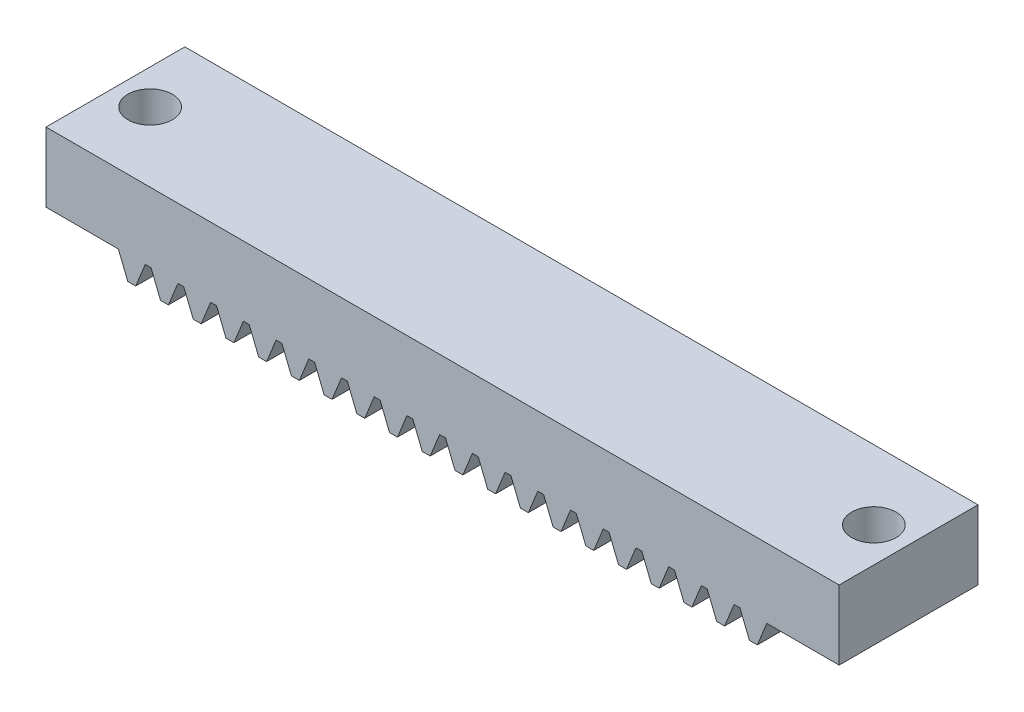
from build123d import *

# Parameters (mm, degrees)
SKETCH1_R           = 6.75
BOSS_EXTRUDE1_DEPTH = 10
CUT_EXTRUDE3_DEPTH  = 14.824796563
FILLET1_R           = 0.01
CIRPATTERN1_DEPTH   = 10
BOSS_EXTRUDE2_DEPTH = 10
FILLET2_R           = 0.01
LPATTERN7_DEPTH     = 10
SKETCH5_W           = 5
SKETCH5_H           = 10
SKETCH5_R           = 1.6
BOSS_EXTRUDE3_DEPTH = 5


# Read off the part's stored shape, not the designer's step: CirPattern1, LPattern7
with BuildPart() as part:
    # Sketch1 → Boss-Extrude1 (new body)
    with BuildSketch(Plane.XY):
        Circle(SKETCH1_R)
    extrude(amount=BOSS_EXTRUDE1_DEPTH)

    # Sketch3 → Cut-Extrude3 (cut, through all)
    with BuildSketch(Plane.XY):
        with BuildLine():
            add(Edge.make_bspline(
                [(0.434163713, 5.546135436), (0.436630111, 5.568887632), (0.447025975, 5.619389016), (0.472378991, 5.707357547), (0.514598388, 5.8199145), (0.556796354, 5.910501464), (0.584227269, 5.963693803), (0.588102842, 5.97110836)],
                knots=[0, 0, 0, 0, 0.040008387, 0.090017613, 0.160030412, 0.250046806, 0.264674884, 0.264674884, 0.264674884, 0.264674884], degree=3))
            add(Edge.make_bspline(
                [(0.588102842, 5.97110836), (0.647776123, 6.085272362), (0.763412421, 6.267141587), (0.941222365, 6.491761304), (1.047182351, 6.60848955), (1.096933403, 6.660273051)],
                knots=[0.264674884, 0.264674884, 0.264674884, 0.264674884, 0.489907489, 0.63993471, 0.765498984, 0.765498984, 0.765498984, 0.765498984], degree=3))
            ThreePointArc((1.096933403, 6.660273051), (0, 6.75), (-1.096933403, 6.660273051))
            add(Edge.make_bspline(
                [(-0.588102842, 5.97110836), (-0.647776123, 6.085272362), (-0.763412421, 6.267141587), (-0.941222365, 6.491761304), (-1.047182351, 6.60848955), (-1.096933403, 6.660273051)],
                knots=[0.264674884, 0.264674884, 0.264674884, 0.264674884, 0.489907489, 0.63993471, 0.765498984, 0.765498984, 0.765498984, 0.765498984], degree=3))
            add(Edge.make_bspline(
                [(-0.434163713, 5.546135436), (-0.436630111, 5.568887632), (-0.447025975, 5.619389016), (-0.472378991, 5.707357547), (-0.514598388, 5.8199145), (-0.556796354, 5.910501464), (-0.584227269, 5.963693803), (-0.588102842, 5.97110836)],
                knots=[0, 0, 0, 0, 0.040008387, 0.090017613, 0.160030412, 0.250046806, 0.264674884, 0.264674884, 0.264674884, 0.264674884], degree=3))
            Line((-0.434163713, 5.546135436), (-0.395094922, 5.047059169))
            ThreePointArc((-0.395094922, 5.047059169), (0, 5.0625), (0.395094922, 5.047059169))
            Line((0.395094922, 5.047059169), (0.434163713, 5.546135436))
        make_face()
    extrude(amount=CUT_EXTRUDE3_DEPTH, mode=Mode.SUBTRACT)

    # Fillet1
    # the kernel refuses this fillet: 0.01 mm, written as the material it adds along each edge
    with BuildSketch(Plane(origin=(-0.395094922, 5.047059169, 0), x_dir=(0.9970264029497734, 0.07706070218364215, 0), z_dir=(0, 0, 1))) as fillet1_piece_1:
        with BuildLine():
            CenterArc((0.009990148, 0.009999995), FILLET1_R, 180.056476902, 89.887046197)
            Line((-9.847e-06, 0.009990138), (0, 0))
            ThreePointArc((0, 0), (0.004990145, 2.459e-06), (0.009980291, 0))
        make_face()
    extrude(amount=10)
    with BuildSketch(Plane(origin=(0.395094922, 5.047059169, 0), x_dir=(0.0780434413729648, 0.9969499592550595, 0), z_dir=(0, 0, 1))) as fillet1_piece_2:
        with BuildLine():
            CenterArc((0.009990143, 0.01), FILLET1_R, 180.112953803, 89.887046197)
            ThreePointArc((-9.838e-06, 0.009980286), (-2.459e-06, 0.004990145), (0, 0))
            Line((0, 0), (0.009990143, 0))
        make_face()
    extrude(amount=10)
    # the kernel refuses this fillet: 0.01 mm, written as the material it takes off along each edge
    with BuildSketch(Plane(origin=(-1.096933403, 6.660273051, -0.0131876), x_dir=(-0.9866435807268535, -0.16289396738520714, 0), z_dir=(0, 0, 1))) as fillet1_2_piece_1:
        with BuildLine():
            CenterArc((0.005268096, 0.009999999), FILLET1_R, 214.398825468, 55.623549601)
            ThreePointArc((-0.002983155, 0.004350498), (-0.001492332, 0.002174732), (0, 0))
            ThreePointArc((0, 0), (0.002636001, -5.15e-07), (0.005272001, 0))
        make_face()
    extrude(amount=10.0263752, mode=Mode.SUBTRACT)
    with BuildSketch(Plane(origin=(1.096933403, 6.660273051, -0.0131876), x_dir=(0.9866435807268739, -0.16289396738508377, 0), z_dir=(0, 0, 1))) as fillet1_2_piece_2:
        with BuildLine():
            CenterArc((0.005268096, -0.009999999), FILLET1_R, 89.977624931, 55.623549601)
            ThreePointArc((-0.002983155, -0.004350498), (-0.001492332, -0.002174732), (0, 0))
            ThreePointArc((0, 0), (0.002636001, 5.15e-07), (0.005272001, 0))
        make_face()
    extrude(amount=10.0263752, mode=Mode.SUBTRACT)

    # CirPattern1 outline → CirPattern1 (cut)
    with BuildSketch(Plane.XY):
        with BuildLine():
            ThreePointArc((-1.530207553, 6.574265346), (-2.583113168, 6.236186844), (-3.56668747, 5.730727745))
            ThreePointArc((-3.56668747, 5.730727745), (-3.562115941, 5.732212366), (-3.557379814, 5.731392561))
            add(Edge.make_bspline(
                [(-2.523529113, 4.957813754), (-2.534514656, 4.977890192), (-2.563445225, 5.020569063), (-2.620532457, 5.092139209), (-2.702611775, 5.17997161), (-2.871243037, 5.334615924), (-3.096323549, 5.493864718), (-3.352329382, 5.636558939), (-3.493249428, 5.703206224), (-3.557379814, 5.731392561)],
                knots=[0, 0, 0, 0, 0.040008387, 0.090017613, 0.160030412, 0.250046806, 0.489907489, 0.63993471, 0.762424399, 0.762424399, 0.762424399, 0.762424399], degree=3))
            Line((-2.523529113, 4.957813754), (-2.300977756, 4.520581557))
            ThreePointArc((-2.300977756, 4.520581557), (-2.295169305, 4.515611526), (-2.287547187, 4.516196864))
            ThreePointArc((-2.287547187, 4.516196864), (-1.937334876, 4.677140133), (-1.5758933, 4.810973556))
            ThreePointArc((-1.5758933, 4.810973556), (-1.570089751, 4.815949311), (-1.569496899, 4.823570849))
            Line((-1.569496899, 4.823570849), (-1.721299177, 5.290108274))
            add(Edge.make_bspline(
                [(-1.721299177, 5.290108274), (-1.72772741, 5.312072411), (-1.737448928, 5.362707932), (-1.747689894, 5.453682436), (-1.751757939, 5.573828165), (-1.741867673, 5.802418517), (-1.695317619, 6.074180375), (-1.61519421, 6.356103888), (-1.562675436, 6.502876154), (-1.537259155, 6.568153935)],
                knots=[0, 0, 0, 0, 0.040008387, 0.090017613, 0.160030412, 0.250046806, 0.489907489, 0.63993471, 0.762424399, 0.762424399, 0.762424399, 0.762424399], degree=3))
            ThreePointArc((-1.537259155, 6.568153935), (-1.534489898, 6.572082573), (-1.530207553, 6.574265346))
        make_face()
        with BuildLine():
            ThreePointArc((-3.929589867, 5.488244116), (-4.772970773, 4.772970773), (-5.488244116, 3.929589867))
            ThreePointArc((-5.488244116, 3.929589867), (-5.484588714, 3.932710927), (-5.479899377, 3.933765962))
            add(Edge.make_bspline(
                [(-4.228710082, 3.614709871), (-4.246542321, 3.629054096), (-4.289603178, 3.657412982), (-4.369733612, 3.701688836), (-4.479177018, 3.751424999), (-4.694151807, 3.829765325), (-4.96304096, 3.890757444), (-5.254166224, 3.924620524), (-5.409864182, 3.932266818), (-5.479899377, 3.933765962)],
                knots=[0, 0, 0, 0, 0.040008387, 0.090017613, 0.160030412, 0.250046806, 0.489907489, 0.63993471, 0.762424399, 0.762424399, 0.762424399, 0.762424399], degree=3))
            Line((-4.228710082, 3.614709871), (-3.85577792, 3.29592671))
            ThreePointArc((-3.85577792, 3.29592671), (-3.848509663, 3.293557797), (-3.841691743, 3.297015438))
            ThreePointArc((-3.841691743, 3.297015438), (-3.57972808, 3.57972808), (-3.297015438, 3.841691743))
            ThreePointArc((-3.297015438, 3.841691743), (-3.293557797, 3.848509663), (-3.29592671, 3.85577792))
            Line((-3.29592671, 3.85577792), (-3.614709871, 4.228710082))
            add(Edge.make_bspline(
                [(-3.614709871, 4.228710082), (-3.629054096, 4.246542321), (-3.657412982, 4.289603178), (-3.701688836, 4.369733612), (-3.751424999, 4.479177018), (-3.829765325, 4.694151807), (-3.890757444, 4.96304096), (-3.924620524, 5.254166224), (-3.932266818, 5.409864182), (-3.933765962, 5.479899377)],
                knots=[0, 0, 0, 0, 0.040008387, 0.090017613, 0.160030412, 0.250046806, 0.489907489, 0.63993471, 0.762424399, 0.762424399, 0.762424399, 0.762424399], degree=3))
            ThreePointArc((-3.933765962, 5.479899377), (-3.932710927, 5.484588714), (-3.929589867, 5.488244116))
        make_face()
        with BuildLine():
            ThreePointArc((-5.730727745, 3.56668747), (-6.236186844, 2.583113168), (-6.574265346, 1.530207553))
            ThreePointArc((-6.574265346, 1.530207553), (-6.572082573, 1.534489898), (-6.568153935, 1.537259155))
            add(Edge.make_bspline(
                [(-5.290108274, 1.721299177), (-5.312072411, 1.72772741), (-5.362707932, 1.737448928), (-5.453682436, 1.747689894), (-5.573828165, 1.751757939), (-5.802418517, 1.741867673), (-6.074180375, 1.695317619), (-6.356103888, 1.61519421), (-6.502876154, 1.562675436), (-6.568153935, 1.537259155)],
                knots=[0, 0, 0, 0, 0.040008387, 0.090017613, 0.160030412, 0.250046806, 0.489907489, 0.63993471, 0.762424399, 0.762424399, 0.762424399, 0.762424399], degree=3))
            Line((-5.290108274, 1.721299177), (-4.823570849, 1.569496899))
            ThreePointArc((-4.823570849, 1.569496899), (-4.815949311, 1.570089751), (-4.810973556, 1.5758933))
            ThreePointArc((-4.810973556, 1.5758933), (-4.677140133, 1.937334876), (-4.516196864, 2.287547187))
            ThreePointArc((-4.516196864, 2.287547187), (-4.515611526, 2.295169305), (-4.520581557, 2.300977756))
            Line((-4.520581557, 2.300977756), (-4.957813754, 2.523529113))
            add(Edge.make_bspline(
                [(-4.957813754, 2.523529113), (-4.977890192, 2.534514656), (-5.020569063, 2.563445225), (-5.092139209, 2.620532457), (-5.17997161, 2.702611775), (-5.334615924, 2.871243037), (-5.493864718, 3.096323549), (-5.636558939, 3.352329382), (-5.703206224, 3.493249428), (-5.731392561, 3.557379814)],
                knots=[0, 0, 0, 0, 0.040008387, 0.090017613, 0.160030412, 0.250046806, 0.489907489, 0.63993471, 0.762424399, 0.762424399, 0.762424399, 0.762424399], degree=3))
            ThreePointArc((-5.731392561, 3.557379814), (-5.732212366, 3.562115941), (-5.730727745, 3.56668747))
        make_face()
        with BuildLine():
            ThreePointArc((-6.659414273, 1.102134989), (-6.75, 0), (-6.659414273, -1.102134989))
            ThreePointArc((-6.659414273, -1.102134989), (-6.659036436, -1.097343307), (-6.656466597, -1.093281423))
            add(Edge.make_bspline(
                [(-5.546135436, -0.434163713), (-5.568887632, -0.436630111), (-5.619389016, -0.447025975), (-5.707357547, -0.472378991), (-5.8199145, -0.514598388), (-6.027319607, -0.611213543), (-6.260580891, -0.758218945), (-6.490382352, -0.940130781), (-6.605884181, -1.044819116), (-6.656466597, -1.093281423)],
                knots=[0, 0, 0, 0, 0.040008387, 0.090017613, 0.160030412, 0.250046806, 0.489907489, 0.63993471, 0.762424399, 0.762424399, 0.762424399, 0.762424399], degree=3))
            Line((-5.546135436, -0.434163713), (-5.057018841, -0.395874587))
            ThreePointArc((-5.057018841, -0.395874587), (-5.050204333, -0.392410227), (-5.047828257, -0.385144309))
            ThreePointArc((-5.047828257, -0.385144309), (-5.0625, 0), (-5.047828257, 0.385144309))
            ThreePointArc((-5.047828257, 0.385144309), (-5.050204333, 0.392410227), (-5.057018841, 0.395874587))
            Line((-5.057018841, 0.395874587), (-5.546135436, 0.434163713))
            add(Edge.make_bspline(
                [(-5.546135436, 0.434163713), (-5.568887632, 0.436630111), (-5.619389016, 0.447025975), (-5.707357547, 0.472378991), (-5.8199145, 0.514598388), (-6.027319607, 0.611213543), (-6.260580891, 0.758218945), (-6.490382352, 0.940130781), (-6.605884181, 1.044819116), (-6.656466597, 1.093281423)],
                knots=[0, 0, 0, 0, 0.040008387, 0.090017613, 0.160030412, 0.250046806, 0.489907489, 0.63993471, 0.762424399, 0.762424399, 0.762424399, 0.762424399], degree=3))
            ThreePointArc((-6.656466597, 1.093281423), (-6.659036436, 1.097343307), (-6.659414273, 1.102134989))
        make_face()
        with BuildLine():
            ThreePointArc((-6.574265346, -1.530207553), (-6.236186844, -2.583113168), (-5.730727745, -3.56668747))
            ThreePointArc((-5.730727745, -3.56668747), (-5.732212366, -3.562115941), (-5.731392561, -3.557379814))
            add(Edge.make_bspline(
                [(-4.957813754, -2.523529113), (-4.977890192, -2.534514656), (-5.020569063, -2.563445225), (-5.092139209, -2.620532457), (-5.17997161, -2.702611775), (-5.334615924, -2.871243037), (-5.493864718, -3.096323549), (-5.636558939, -3.352329382), (-5.703206224, -3.493249428), (-5.731392561, -3.557379814)],
                knots=[0, 0, 0, 0, 0.040008387, 0.090017613, 0.160030412, 0.250046806, 0.489907489, 0.63993471, 0.762424399, 0.762424399, 0.762424399, 0.762424399], degree=3))
            Line((-4.957813754, -2.523529113), (-4.520581557, -2.300977756))
            ThreePointArc((-4.520581557, -2.300977756), (-4.515611526, -2.295169305), (-4.516196864, -2.287547187))
            ThreePointArc((-4.516196864, -2.287547187), (-4.677140133, -1.937334876), (-4.810973556, -1.5758933))
            ThreePointArc((-4.810973556, -1.5758933), (-4.815949311, -1.570089751), (-4.823570849, -1.569496899))
            Line((-4.823570849, -1.569496899), (-5.290108274, -1.721299177))
            add(Edge.make_bspline(
                [(-5.290108274, -1.721299177), (-5.312072411, -1.72772741), (-5.362707932, -1.737448928), (-5.453682436, -1.747689894), (-5.573828165, -1.751757939), (-5.802418517, -1.741867673), (-6.074180375, -1.695317619), (-6.356103888, -1.61519421), (-6.502876154, -1.562675436), (-6.568153935, -1.537259155)],
                knots=[0, 0, 0, 0, 0.040008387, 0.090017613, 0.160030412, 0.250046806, 0.489907489, 0.63993471, 0.762424399, 0.762424399, 0.762424399, 0.762424399], degree=3))
            ThreePointArc((-6.568153935, -1.537259155), (-6.572082573, -1.534489898), (-6.574265346, -1.530207553))
        make_face()
        with BuildLine():
            ThreePointArc((-5.488244116, -3.929589867), (-4.772970773, -4.772970773), (-3.929589867, -5.488244116))
            ThreePointArc((-3.929589867, -5.488244116), (-3.932710927, -5.484588714), (-3.933765962, -5.479899377))
            add(Edge.make_bspline(
                [(-3.614709871, -4.228710082), (-3.629054096, -4.246542321), (-3.657412982, -4.289603178), (-3.701688836, -4.369733612), (-3.751424999, -4.479177018), (-3.829765325, -4.694151807), (-3.890757444, -4.96304096), (-3.924620524, -5.254166224), (-3.932266818, -5.409864182), (-3.933765962, -5.479899377)],
                knots=[0, 0, 0, 0, 0.040008387, 0.090017613, 0.160030412, 0.250046806, 0.489907489, 0.63993471, 0.762424399, 0.762424399, 0.762424399, 0.762424399], degree=3))
            Line((-3.614709871, -4.228710082), (-3.29592671, -3.85577792))
            ThreePointArc((-3.29592671, -3.85577792), (-3.293557797, -3.848509663), (-3.297015438, -3.841691743))
            ThreePointArc((-3.297015438, -3.841691743), (-3.57972808, -3.57972808), (-3.841691743, -3.297015438))
            ThreePointArc((-3.841691743, -3.297015438), (-3.848509663, -3.293557797), (-3.85577792, -3.29592671))
            Line((-3.85577792, -3.29592671), (-4.228710082, -3.614709871))
            add(Edge.make_bspline(
                [(-4.228710082, -3.614709871), (-4.246542321, -3.629054096), (-4.289603178, -3.657412982), (-4.369733612, -3.701688836), (-4.479177018, -3.751424999), (-4.694151807, -3.829765325), (-4.96304096, -3.890757444), (-5.254166224, -3.924620524), (-5.409864182, -3.932266818), (-5.479899377, -3.933765962)],
                knots=[0, 0, 0, 0, 0.040008387, 0.090017613, 0.160030412, 0.250046806, 0.489907489, 0.63993471, 0.762424399, 0.762424399, 0.762424399, 0.762424399], degree=3))
            ThreePointArc((-5.479899377, -3.933765962), (-5.484588714, -3.932710927), (-5.488244116, -3.929589867))
        make_face()
        with BuildLine():
            ThreePointArc((-3.56668747, -5.730727745), (-2.583113168, -6.236186844), (-1.530207553, -6.574265346))
            ThreePointArc((-1.530207553, -6.574265346), (-1.534489898, -6.572082573), (-1.537259155, -6.568153935))
            add(Edge.make_bspline(
                [(-1.721299177, -5.290108274), (-1.72772741, -5.312072411), (-1.737448928, -5.362707932), (-1.747689894, -5.453682436), (-1.751757939, -5.573828165), (-1.741867673, -5.802418517), (-1.695317619, -6.074180375), (-1.61519421, -6.356103888), (-1.562675436, -6.502876154), (-1.537259155, -6.568153935)],
                knots=[0, 0, 0, 0, 0.040008387, 0.090017613, 0.160030412, 0.250046806, 0.489907489, 0.63993471, 0.762424399, 0.762424399, 0.762424399, 0.762424399], degree=3))
            Line((-1.721299177, -5.290108274), (-1.569496899, -4.823570849))
            ThreePointArc((-1.569496899, -4.823570849), (-1.570089751, -4.815949311), (-1.5758933, -4.810973556))
            ThreePointArc((-1.5758933, -4.810973556), (-1.937334876, -4.677140133), (-2.287547187, -4.516196864))
            ThreePointArc((-2.287547187, -4.516196864), (-2.295169305, -4.515611526), (-2.300977756, -4.520581557))
            Line((-2.300977756, -4.520581557), (-2.523529113, -4.957813754))
            add(Edge.make_bspline(
                [(-2.523529113, -4.957813754), (-2.534514656, -4.977890192), (-2.563445225, -5.020569063), (-2.620532457, -5.092139209), (-2.702611775, -5.17997161), (-2.871243037, -5.334615924), (-3.096323549, -5.493864718), (-3.352329382, -5.636558939), (-3.493249428, -5.703206224), (-3.557379814, -5.731392561)],
                knots=[0, 0, 0, 0, 0.040008387, 0.090017613, 0.160030412, 0.250046806, 0.489907489, 0.63993471, 0.762424399, 0.762424399, 0.762424399, 0.762424399], degree=3))
            ThreePointArc((-3.557379814, -5.731392561), (-3.562115941, -5.732212366), (-3.56668747, -5.730727745))
        make_face()
        with BuildLine():
            ThreePointArc((-1.102134989, -6.659414273), (0, -6.75), (1.102134989, -6.659414273))
            ThreePointArc((1.102134989, -6.659414273), (1.097343307, -6.659036436), (1.093281423, -6.656466597))
            add(Edge.make_bspline(
                [(0.434163713, -5.546135436), (0.436630111, -5.568887632), (0.447025975, -5.619389016), (0.472378991, -5.707357547), (0.514598388, -5.8199145), (0.611213543, -6.027319607), (0.758218945, -6.260580891), (0.940130781, -6.490382352), (1.044819116, -6.605884181), (1.093281423, -6.656466597)],
                knots=[0, 0, 0, 0, 0.040008387, 0.090017613, 0.160030412, 0.250046806, 0.489907489, 0.63993471, 0.762424399, 0.762424399, 0.762424399, 0.762424399], degree=3))
            Line((0.434163713, -5.546135436), (0.395874587, -5.057018841))
            ThreePointArc((0.395874587, -5.057018841), (0.392410227, -5.050204333), (0.385144309, -5.047828257))
            ThreePointArc((0.385144309, -5.047828257), (0, -5.0625), (-0.385144309, -5.047828257))
            ThreePointArc((-0.385144309, -5.047828257), (-0.392410227, -5.050204333), (-0.395874587, -5.057018841))
            Line((-0.395874587, -5.057018841), (-0.434163713, -5.546135436))
            add(Edge.make_bspline(
                [(-0.434163713, -5.546135436), (-0.436630111, -5.568887632), (-0.447025975, -5.619389016), (-0.472378991, -5.707357547), (-0.514598388, -5.8199145), (-0.611213543, -6.027319607), (-0.758218945, -6.260580891), (-0.940130781, -6.490382352), (-1.044819116, -6.605884181), (-1.093281423, -6.656466597)],
                knots=[0, 0, 0, 0, 0.040008387, 0.090017613, 0.160030412, 0.250046806, 0.489907489, 0.63993471, 0.762424399, 0.762424399, 0.762424399, 0.762424399], degree=3))
            ThreePointArc((-1.093281423, -6.656466597), (-1.097343307, -6.659036436), (-1.102134989, -6.659414273))
        make_face()
        with BuildLine():
            ThreePointArc((1.530207553, -6.574265346), (2.583113168, -6.236186844), (3.56668747, -5.730727745))
            ThreePointArc((3.56668747, -5.730727745), (3.562115941, -5.732212366), (3.557379814, -5.731392561))
            add(Edge.make_bspline(
                [(2.523529113, -4.957813754), (2.534514656, -4.977890192), (2.563445225, -5.020569063), (2.620532457, -5.092139209), (2.702611775, -5.17997161), (2.871243037, -5.334615924), (3.096323549, -5.493864718), (3.352329382, -5.636558939), (3.493249428, -5.703206224), (3.557379814, -5.731392561)],
                knots=[0, 0, 0, 0, 0.040008387, 0.090017613, 0.160030412, 0.250046806, 0.489907489, 0.63993471, 0.762424399, 0.762424399, 0.762424399, 0.762424399], degree=3))
            Line((2.523529113, -4.957813754), (2.300977756, -4.520581557))
            ThreePointArc((2.300977756, -4.520581557), (2.295169305, -4.515611526), (2.287547187, -4.516196864))
            ThreePointArc((2.287547187, -4.516196864), (1.937334876, -4.677140133), (1.5758933, -4.810973556))
            ThreePointArc((1.5758933, -4.810973556), (1.570089751, -4.815949311), (1.569496899, -4.823570849))
            Line((1.569496899, -4.823570849), (1.721299177, -5.290108274))
            add(Edge.make_bspline(
                [(1.721299177, -5.290108274), (1.72772741, -5.312072411), (1.737448928, -5.362707932), (1.747689894, -5.453682436), (1.751757939, -5.573828165), (1.741867673, -5.802418517), (1.695317619, -6.074180375), (1.61519421, -6.356103888), (1.562675436, -6.502876154), (1.537259155, -6.568153935)],
                knots=[0, 0, 0, 0, 0.040008387, 0.090017613, 0.160030412, 0.250046806, 0.489907489, 0.63993471, 0.762424399, 0.762424399, 0.762424399, 0.762424399], degree=3))
            ThreePointArc((1.537259155, -6.568153935), (1.534489898, -6.572082573), (1.530207553, -6.574265346))
        make_face()
        with BuildLine():
            ThreePointArc((3.929589867, -5.488244116), (4.772970773, -4.772970773), (5.488244116, -3.929589867))
            ThreePointArc((5.488244116, -3.929589867), (5.484588714, -3.932710927), (5.479899377, -3.933765962))
            add(Edge.make_bspline(
                [(4.228710082, -3.614709871), (4.246542321, -3.629054096), (4.289603178, -3.657412982), (4.369733612, -3.701688836), (4.479177018, -3.751424999), (4.694151807, -3.829765325), (4.96304096, -3.890757444), (5.254166224, -3.924620524), (5.409864182, -3.932266818), (5.479899377, -3.933765962)],
                knots=[0, 0, 0, 0, 0.040008387, 0.090017613, 0.160030412, 0.250046806, 0.489907489, 0.63993471, 0.762424399, 0.762424399, 0.762424399, 0.762424399], degree=3))
            Line((4.228710082, -3.614709871), (3.85577792, -3.29592671))
            ThreePointArc((3.85577792, -3.29592671), (3.848509663, -3.293557797), (3.841691743, -3.297015438))
            ThreePointArc((3.841691743, -3.297015438), (3.57972808, -3.57972808), (3.297015438, -3.841691743))
            ThreePointArc((3.297015438, -3.841691743), (3.293557797, -3.848509663), (3.29592671, -3.85577792))
            Line((3.29592671, -3.85577792), (3.614709871, -4.228710082))
            add(Edge.make_bspline(
                [(3.614709871, -4.228710082), (3.629054096, -4.246542321), (3.657412982, -4.289603178), (3.701688836, -4.369733612), (3.751424999, -4.479177018), (3.829765325, -4.694151807), (3.890757444, -4.96304096), (3.924620524, -5.254166224), (3.932266818, -5.409864182), (3.933765962, -5.479899377)],
                knots=[0, 0, 0, 0, 0.040008387, 0.090017613, 0.160030412, 0.250046806, 0.489907489, 0.63993471, 0.762424399, 0.762424399, 0.762424399, 0.762424399], degree=3))
            ThreePointArc((3.933765962, -5.479899377), (3.932710927, -5.484588714), (3.929589867, -5.488244116))
        make_face()
        with BuildLine():
            ThreePointArc((5.730727745, -3.56668747), (6.236186844, -2.583113168), (6.574265346, -1.530207553))
            ThreePointArc((6.574265346, -1.530207553), (6.572082573, -1.534489898), (6.568153935, -1.537259155))
            add(Edge.make_bspline(
                [(5.290108274, -1.721299177), (5.312072411, -1.72772741), (5.362707932, -1.737448928), (5.453682436, -1.747689894), (5.573828165, -1.751757939), (5.802418517, -1.741867673), (6.074180375, -1.695317619), (6.356103888, -1.61519421), (6.502876154, -1.562675436), (6.568153935, -1.537259155)],
                knots=[0, 0, 0, 0, 0.040008387, 0.090017613, 0.160030412, 0.250046806, 0.489907489, 0.63993471, 0.762424399, 0.762424399, 0.762424399, 0.762424399], degree=3))
            Line((5.290108274, -1.721299177), (4.823570849, -1.569496899))
            ThreePointArc((4.823570849, -1.569496899), (4.815949311, -1.570089751), (4.810973556, -1.5758933))
            ThreePointArc((4.810973556, -1.5758933), (4.677140133, -1.937334876), (4.516196864, -2.287547187))
            ThreePointArc((4.516196864, -2.287547187), (4.515611526, -2.295169305), (4.520581557, -2.300977756))
            Line((4.520581557, -2.300977756), (4.957813754, -2.523529113))
            add(Edge.make_bspline(
                [(4.957813754, -2.523529113), (4.977890192, -2.534514656), (5.020569063, -2.563445225), (5.092139209, -2.620532457), (5.17997161, -2.702611775), (5.334615924, -2.871243037), (5.493864718, -3.096323549), (5.636558939, -3.352329382), (5.703206224, -3.493249428), (5.731392561, -3.557379814)],
                knots=[0, 0, 0, 0, 0.040008387, 0.090017613, 0.160030412, 0.250046806, 0.489907489, 0.63993471, 0.762424399, 0.762424399, 0.762424399, 0.762424399], degree=3))
            ThreePointArc((5.731392561, -3.557379814), (5.732212366, -3.562115941), (5.730727745, -3.56668747))
        make_face()
        with BuildLine():
            ThreePointArc((6.659414273, -1.102134989), (6.75, 0), (6.659414273, 1.102134989))
            ThreePointArc((6.659414273, 1.102134989), (6.659036436, 1.097343307), (6.656466597, 1.093281423))
            add(Edge.make_bspline(
                [(5.546135436, 0.434163713), (5.568887632, 0.436630111), (5.619389016, 0.447025975), (5.707357547, 0.472378991), (5.8199145, 0.514598388), (6.027319607, 0.611213543), (6.260580891, 0.758218945), (6.490382352, 0.940130781), (6.605884181, 1.044819116), (6.656466597, 1.093281423)],
                knots=[0, 0, 0, 0, 0.040008387, 0.090017613, 0.160030412, 0.250046806, 0.489907489, 0.63993471, 0.762424399, 0.762424399, 0.762424399, 0.762424399], degree=3))
            Line((5.546135436, 0.434163713), (5.057018841, 0.395874587))
            ThreePointArc((5.057018841, 0.395874587), (5.050204333, 0.392410227), (5.047828257, 0.385144309))
            ThreePointArc((5.047828257, 0.385144309), (5.0625, 0), (5.047828257, -0.385144309))
            ThreePointArc((5.047828257, -0.385144309), (5.050204333, -0.392410227), (5.057018841, -0.395874587))
            Line((5.057018841, -0.395874587), (5.546135436, -0.434163713))
            add(Edge.make_bspline(
                [(5.546135436, -0.434163713), (5.568887632, -0.436630111), (5.619389016, -0.447025975), (5.707357547, -0.472378991), (5.8199145, -0.514598388), (6.027319607, -0.611213543), (6.260580891, -0.758218945), (6.490382352, -0.940130781), (6.605884181, -1.044819116), (6.656466597, -1.093281423)],
                knots=[0, 0, 0, 0, 0.040008387, 0.090017613, 0.160030412, 0.250046806, 0.489907489, 0.63993471, 0.762424399, 0.762424399, 0.762424399, 0.762424399], degree=3))
            ThreePointArc((6.656466597, -1.093281423), (6.659036436, -1.097343307), (6.659414273, -1.102134989))
        make_face()
        with BuildLine():
            ThreePointArc((6.574265346, 1.530207553), (6.236186844, 2.583113168), (5.730727745, 3.56668747))
            ThreePointArc((5.730727745, 3.56668747), (5.732212366, 3.562115941), (5.731392561, 3.557379814))
            add(Edge.make_bspline(
                [(4.957813754, 2.523529113), (4.977890192, 2.534514656), (5.020569063, 2.563445225), (5.092139209, 2.620532457), (5.17997161, 2.702611775), (5.334615924, 2.871243037), (5.493864718, 3.096323549), (5.636558939, 3.352329382), (5.703206224, 3.493249428), (5.731392561, 3.557379814)],
                knots=[0, 0, 0, 0, 0.040008387, 0.090017613, 0.160030412, 0.250046806, 0.489907489, 0.63993471, 0.762424399, 0.762424399, 0.762424399, 0.762424399], degree=3))
            Line((4.957813754, 2.523529113), (4.520581557, 2.300977756))
            ThreePointArc((4.520581557, 2.300977756), (4.515611526, 2.295169305), (4.516196864, 2.287547187))
            ThreePointArc((4.516196864, 2.287547187), (4.677140133, 1.937334876), (4.810973556, 1.5758933))
            ThreePointArc((4.810973556, 1.5758933), (4.815949311, 1.570089751), (4.823570849, 1.569496899))
            Line((4.823570849, 1.569496899), (5.290108274, 1.721299177))
            add(Edge.make_bspline(
                [(5.290108274, 1.721299177), (5.312072411, 1.72772741), (5.362707932, 1.737448928), (5.453682436, 1.747689894), (5.573828165, 1.751757939), (5.802418517, 1.741867673), (6.074180375, 1.695317619), (6.356103888, 1.61519421), (6.502876154, 1.562675436), (6.568153935, 1.537259155)],
                knots=[0, 0, 0, 0, 0.040008387, 0.090017613, 0.160030412, 0.250046806, 0.489907489, 0.63993471, 0.762424399, 0.762424399, 0.762424399, 0.762424399], degree=3))
            ThreePointArc((6.568153935, 1.537259155), (6.572082573, 1.534489898), (6.574265346, 1.530207553))
        make_face()
        with BuildLine():
            ThreePointArc((5.488244116, 3.929589867), (4.772970773, 4.772970773), (3.929589867, 5.488244116))
            ThreePointArc((3.929589867, 5.488244116), (3.932710927, 5.484588714), (3.933765962, 5.479899377))
            add(Edge.make_bspline(
                [(3.614709871, 4.228710082), (3.629054096, 4.246542321), (3.657412982, 4.289603178), (3.701688836, 4.369733612), (3.751424999, 4.479177018), (3.829765325, 4.694151807), (3.890757444, 4.96304096), (3.924620524, 5.254166224), (3.932266818, 5.409864182), (3.933765962, 5.479899377)],
                knots=[0, 0, 0, 0, 0.040008387, 0.090017613, 0.160030412, 0.250046806, 0.489907489, 0.63993471, 0.762424399, 0.762424399, 0.762424399, 0.762424399], degree=3))
            Line((3.614709871, 4.228710082), (3.29592671, 3.85577792))
            ThreePointArc((3.29592671, 3.85577792), (3.293557797, 3.848509663), (3.297015438, 3.841691743))
            ThreePointArc((3.297015438, 3.841691743), (3.57972808, 3.57972808), (3.841691743, 3.297015438))
            ThreePointArc((3.841691743, 3.297015438), (3.848509663, 3.293557797), (3.85577792, 3.29592671))
            Line((3.85577792, 3.29592671), (4.228710082, 3.614709871))
            add(Edge.make_bspline(
                [(4.228710082, 3.614709871), (4.246542321, 3.629054096), (4.289603178, 3.657412982), (4.369733612, 3.701688836), (4.479177018, 3.751424999), (4.694151807, 3.829765325), (4.96304096, 3.890757444), (5.254166224, 3.924620524), (5.409864182, 3.932266818), (5.479899377, 3.933765962)],
                knots=[0, 0, 0, 0, 0.040008387, 0.090017613, 0.160030412, 0.250046806, 0.489907489, 0.63993471, 0.762424399, 0.762424399, 0.762424399, 0.762424399], degree=3))
            ThreePointArc((5.479899377, 3.933765962), (5.484588714, 3.932710927), (5.488244116, 3.929589867))
        make_face()
        with BuildLine():
            add(Edge.make_bspline(
                [(1.721299177, 5.290108274), (1.72772741, 5.312072411), (1.737448928, 5.362707932), (1.747689894, 5.453682436), (1.751757939, 5.573828165), (1.741867673, 5.802418517), (1.695317619, 6.074180375), (1.61519421, 6.356103888), (1.562675436, 6.502876154), (1.537259155, 6.568153935)],
                knots=[0, 0, 0, 0, 0.040008387, 0.090017613, 0.160030412, 0.250046806, 0.489907489, 0.63993471, 0.762424399, 0.762424399, 0.762424399, 0.762424399], degree=3))
            Line((1.721299177, 5.290108274), (1.569496899, 4.823570849))
            ThreePointArc((1.569496899, 4.823570849), (1.570089751, 4.815949311), (1.5758933, 4.810973556))
            ThreePointArc((1.5758933, 4.810973556), (1.937334876, 4.677140133), (2.287547187, 4.516196864))
            ThreePointArc((2.287547187, 4.516196864), (2.295169305, 4.515611526), (2.300977756, 4.520581557))
            Line((2.300977756, 4.520581557), (2.523529113, 4.957813754))
            add(Edge.make_bspline(
                [(2.523529113, 4.957813754), (2.534514656, 4.977890192), (2.563445225, 5.020569063), (2.620532457, 5.092139209), (2.702611775, 5.17997161), (2.871243037, 5.334615924), (3.096323549, 5.493864718), (3.352329382, 5.636558939), (3.493249428, 5.703206224), (3.557379814, 5.731392561)],
                knots=[0, 0, 0, 0, 0.040008387, 0.090017613, 0.160030412, 0.250046806, 0.489907489, 0.63993471, 0.762424399, 0.762424399, 0.762424399, 0.762424399], degree=3))
            ThreePointArc((3.557379814, 5.731392561), (3.562115941, 5.732212366), (3.56668747, 5.730727745))
            ThreePointArc((3.56668747, 5.730727745), (2.583113168, 6.236186844), (1.530207553, 6.574265346))
            ThreePointArc((1.530207553, 6.574265346), (1.534489898, 6.572082573), (1.537259155, 6.568153935))
        make_face()
    extrude(amount=CIRPATTERN1_DEPTH, mode=Mode.SUBTRACT)


with BuildPart() as body_2:
    # Sketch4 → Boss-Extrude2 (new body)
    with BuildSketch(Plane.XY):
        Polygon((0.967829207, 6.9375), (0.28603495, 5.25), (-0.28603495, 5.25), (-0.967829207, 6.9375), (-1.178097245, 6.9375), (-1.178097245, 11.9375), (1.178097245, 11.9375), (1.178097245, 6.9375), align=None)
    extrude(amount=BOSS_EXTRUDE2_DEPTH)

    # Fillet2
    fillet2_edges = [body_2.edges().sort_by_distance(p)[0] for p in [
        (-0.28603495, 5.25, 5),
        (0.28603495, 5.25, 5),
        (0.967829207, 6.9375, 5),
        (-0.967829207, 6.9375, 5),
    ]]
    fillet(fillet2_edges, radius=FILLET2_R)

    # LPattern7 outline → LPattern7 (add)
    with BuildSketch(Plane.XY):
        with BuildLine():
            Line((1.178097245, 6.9375), (1.381620198, 6.9375))
            ThreePointArc((1.381620198, 6.9375), (1.387212127, 6.935790376), (1.390892037, 6.931246066))
            Line((1.390892037, 6.931246066), (2.067632786, 5.256253934))
            ThreePointArc((2.067632786, 5.256253934), (2.071312696, 5.251709624), (2.076904625, 5.25))
            Line((2.076904625, 5.25), (2.635484356, 5.25))
            ThreePointArc((2.635484356, 5.25), (2.641076285, 5.251709624), (2.644756194, 5.256253934))
            Line((2.644756194, 5.256253934), (3.321496943, 6.931246066))
            ThreePointArc((3.321496943, 6.931246066), (3.325176853, 6.935790376), (3.330768782, 6.9375))
            Line((3.330768782, 6.9375), (3.737814689, 6.9375))
            ThreePointArc((3.737814689, 6.9375), (3.743406618, 6.935790376), (3.747086527, 6.931246066))
            Line((3.747086527, 6.931246066), (4.423827277, 5.256253934))
            ThreePointArc((4.423827277, 5.256253934), (4.427507186, 5.251709624), (4.433099115, 5.25))
            Line((4.433099115, 5.25), (4.991678846, 5.25))
            ThreePointArc((4.991678846, 5.25), (4.997270775, 5.251709624), (5.000950684, 5.256253934))
            Line((5.000950684, 5.256253934), (5.677691434, 6.931246066))
            ThreePointArc((5.677691434, 6.931246066), (5.681371343, 6.935790376), (5.686963272, 6.9375))
            Line((5.686963272, 6.9375), (6.094009179, 6.9375))
            ThreePointArc((6.094009179, 6.9375), (6.099601108, 6.935790376), (6.103281017, 6.931246066))
            Line((6.103281017, 6.931246066), (6.780021767, 5.256253934))
            ThreePointArc((6.780021767, 5.256253934), (6.783701676, 5.251709624), (6.789293605, 5.25))
            Line((6.789293605, 5.25), (7.347873336, 5.25))
            ThreePointArc((7.347873336, 5.25), (7.353465265, 5.251709624), (7.357145174, 5.256253934))
            Line((7.357145174, 5.256253934), (8.033885924, 6.931246066))
            ThreePointArc((8.033885924, 6.931246066), (8.037565833, 6.935790376), (8.043157762, 6.9375))
            Line((8.043157762, 6.9375), (8.450203669, 6.9375))
            ThreePointArc((8.450203669, 6.9375), (8.455795598, 6.935790376), (8.459475508, 6.931246066))
            Line((8.459475508, 6.931246066), (9.136216257, 5.256253934))
            ThreePointArc((9.136216257, 5.256253934), (9.139896166, 5.251709624), (9.145488095, 5.25))
            Line((9.145488095, 5.25), (9.704067826, 5.25))
            ThreePointArc((9.704067826, 5.25), (9.709659755, 5.251709624), (9.713339665, 5.256253934))
            Line((9.713339665, 5.256253934), (10.390080414, 6.931246066))
            ThreePointArc((10.390080414, 6.931246066), (10.393760323, 6.935790376), (10.399352253, 6.9375))
            Line((10.399352253, 6.9375), (10.806398159, 6.9375))
            ThreePointArc((10.806398159, 6.9375), (10.811990088, 6.935790376), (10.815669998, 6.931246066))
            Line((10.815669998, 6.931246066), (11.492410747, 5.256253934))
            ThreePointArc((11.492410747, 5.256253934), (11.496090657, 5.251709624), (11.501682586, 5.25))
            Line((11.501682586, 5.25), (12.060262316, 5.25))
            ThreePointArc((12.060262316, 5.25), (12.065854245, 5.251709624), (12.069534155, 5.256253934))
            Line((12.069534155, 5.256253934), (12.746274904, 6.931246066))
            ThreePointArc((12.746274904, 6.931246066), (12.749954814, 6.935790376), (12.755546743, 6.9375))
            Line((12.755546743, 6.9375), (13.162592649, 6.9375))
            ThreePointArc((13.162592649, 6.9375), (13.168184578, 6.935790376), (13.171864488, 6.931246066))
            Line((13.171864488, 6.931246066), (13.848605237, 5.256253934))
            ThreePointArc((13.848605237, 5.256253934), (13.852285147, 5.251709624), (13.857877076, 5.25))
            Line((13.857877076, 5.25), (14.416456806, 5.25))
            ThreePointArc((14.416456806, 5.25), (14.422048735, 5.251709624), (14.425728645, 5.256253934))
            Line((14.425728645, 5.256253934), (15.102469394, 6.931246066))
            ThreePointArc((15.102469394, 6.931246066), (15.106149304, 6.935790376), (15.111741233, 6.9375))
            Line((15.111741233, 6.9375), (15.51878714, 6.9375))
            ThreePointArc((15.51878714, 6.9375), (15.524379069, 6.935790376), (15.528058978, 6.931246066))
            Line((15.528058978, 6.931246066), (16.204799727, 5.256253934))
            ThreePointArc((16.204799727, 5.256253934), (16.208479637, 5.251709624), (16.214071566, 5.25))
            Line((16.214071566, 5.25), (16.772651297, 5.25))
            ThreePointArc((16.772651297, 5.25), (16.778243226, 5.251709624), (16.781923135, 5.256253934))
            Line((16.781923135, 5.256253934), (17.458663885, 6.931246066))
            ThreePointArc((17.458663885, 6.931246066), (17.462343794, 6.935790376), (17.467935723, 6.9375))
            Line((17.467935723, 6.9375), (17.87498163, 6.9375))
            ThreePointArc((17.87498163, 6.9375), (17.880573559, 6.935790376), (17.884253468, 6.931246066))
            Line((17.884253468, 6.931246066), (18.560994218, 5.256253934))
            ThreePointArc((18.560994218, 5.256253934), (18.564674127, 5.251709624), (18.570266056, 5.25))
            Line((18.570266056, 5.25), (19.128845787, 5.25))
            ThreePointArc((19.128845787, 5.25), (19.134437716, 5.251709624), (19.138117625, 5.256253934))
            Line((19.138117625, 5.256253934), (19.814858375, 6.931246066))
            ThreePointArc((19.814858375, 6.931246066), (19.818538284, 6.935790376), (19.824130213, 6.9375))
            Line((19.824130213, 6.9375), (20.23117612, 6.9375))
            ThreePointArc((20.23117612, 6.9375), (20.236768049, 6.935790376), (20.240447959, 6.931246066))
            Line((20.240447959, 6.931246066), (20.917188708, 5.256253934))
            ThreePointArc((20.917188708, 5.256253934), (20.920868617, 5.251709624), (20.926460546, 5.25))
            Line((20.926460546, 5.25), (21.485040277, 5.25))
            ThreePointArc((21.485040277, 5.25), (21.490632206, 5.251709624), (21.494312116, 5.256253934))
            Line((21.494312116, 5.256253934), (22.171052865, 6.931246066))
            ThreePointArc((22.171052865, 6.931246066), (22.174732774, 6.935790376), (22.180324703, 6.9375))
            Line((22.180324703, 6.9375), (22.58737061, 6.9375))
            ThreePointArc((22.58737061, 6.9375), (22.592962539, 6.935790376), (22.596642449, 6.931246066))
            Line((22.596642449, 6.931246066), (23.273383198, 5.256253934))
            ThreePointArc((23.273383198, 5.256253934), (23.277063108, 5.251709624), (23.282655037, 5.25))
            Line((23.282655037, 5.25), (23.841234767, 5.25))
            ThreePointArc((23.841234767, 5.25), (23.846826696, 5.251709624), (23.850506606, 5.256253934))
            Line((23.850506606, 5.256253934), (24.527247355, 6.931246066))
            ThreePointArc((24.527247355, 6.931246066), (24.530927265, 6.935790376), (24.536519194, 6.9375))
            Line((24.536519194, 6.9375), (24.9435651, 6.9375))
            ThreePointArc((24.9435651, 6.9375), (24.949157029, 6.935790376), (24.952836939, 6.931246066))
            Line((24.952836939, 6.931246066), (25.629577688, 5.256253934))
            ThreePointArc((25.629577688, 5.256253934), (25.633257598, 5.251709624), (25.638849527, 5.25))
            Line((25.638849527, 5.25), (26.197429257, 5.25))
            ThreePointArc((26.197429257, 5.25), (26.203021186, 5.251709624), (26.206701096, 5.256253934))
            Line((26.206701096, 5.256253934), (26.883441845, 6.931246066))
            ThreePointArc((26.883441845, 6.931246066), (26.887121755, 6.935790376), (26.892713684, 6.9375))
            Line((26.892713684, 6.9375), (27.299759591, 6.9375))
            ThreePointArc((27.299759591, 6.9375), (27.30535152, 6.935790376), (27.309031429, 6.931246066))
            Line((27.309031429, 6.931246066), (27.985772178, 5.256253934))
            ThreePointArc((27.985772178, 5.256253934), (27.989452088, 5.251709624), (27.995044017, 5.25))
            Line((27.995044017, 5.25), (28.553623748, 5.25))
            ThreePointArc((28.553623748, 5.25), (28.559215677, 5.251709624), (28.562895586, 5.256253934))
            Line((28.562895586, 5.256253934), (29.239636336, 6.931246066))
            ThreePointArc((29.239636336, 6.931246066), (29.243316245, 6.935790376), (29.248908174, 6.9375))
            Line((29.248908174, 6.9375), (29.655954081, 6.9375))
            ThreePointArc((29.655954081, 6.9375), (29.66154601, 6.935790376), (29.665225919, 6.931246066))
            Line((29.665225919, 6.931246066), (30.341966669, 5.256253934))
            ThreePointArc((30.341966669, 5.256253934), (30.345646578, 5.251709624), (30.351238507, 5.25))
            Line((30.351238507, 5.25), (30.909818238, 5.25))
            ThreePointArc((30.909818238, 5.25), (30.915410167, 5.251709624), (30.919090076, 5.256253934))
            Line((30.919090076, 5.256253934), (31.595830826, 6.931246066))
            ThreePointArc((31.595830826, 6.931246066), (31.599510735, 6.935790376), (31.605102664, 6.9375))
            Line((31.605102664, 6.9375), (32.012148571, 6.9375))
            ThreePointArc((32.012148571, 6.9375), (32.0177405, 6.935790376), (32.021420409, 6.931246066))
            Line((32.021420409, 6.931246066), (32.698161159, 5.256253934))
            ThreePointArc((32.698161159, 5.256253934), (32.701841068, 5.251709624), (32.707432997, 5.25))
            Line((32.707432997, 5.25), (33.266012728, 5.25))
            ThreePointArc((33.266012728, 5.25), (33.271604657, 5.251709624), (33.275284567, 5.256253934))
            Line((33.275284567, 5.256253934), (33.952025316, 6.931246066))
            ThreePointArc((33.952025316, 6.931246066), (33.955705225, 6.935790376), (33.961297154, 6.9375))
            Line((33.961297154, 6.9375), (34.368343061, 6.9375))
            ThreePointArc((34.368343061, 6.9375), (34.37393499, 6.935790376), (34.3776149, 6.931246066))
            Line((34.3776149, 6.931246066), (35.054355649, 5.256253934))
            ThreePointArc((35.054355649, 5.256253934), (35.058035559, 5.251709624), (35.063627488, 5.25))
            Line((35.063627488, 5.25), (35.622207218, 5.25))
            ThreePointArc((35.622207218, 5.25), (35.627799147, 5.251709624), (35.631479057, 5.256253934))
            Line((35.631479057, 5.256253934), (36.308219806, 6.931246066))
            ThreePointArc((36.308219806, 6.931246066), (36.311899716, 6.935790376), (36.317491645, 6.9375))
            Line((36.317491645, 6.9375), (36.724537551, 6.9375))
            ThreePointArc((36.724537551, 6.9375), (36.73012948, 6.935790376), (36.73380939, 6.931246066))
            Line((36.73380939, 6.931246066), (37.410550139, 5.256253934))
            ThreePointArc((37.410550139, 5.256253934), (37.414230049, 5.251709624), (37.419821978, 5.25))
            Line((37.419821978, 5.25), (37.978401708, 5.25))
            ThreePointArc((37.978401708, 5.25), (37.983993637, 5.251709624), (37.987673547, 5.256253934))
            Line((37.987673547, 5.256253934), (38.664414296, 6.931246066))
            ThreePointArc((38.664414296, 6.931246066), (38.668094206, 6.935790376), (38.673686135, 6.9375))
            Line((38.673686135, 6.9375), (39.080732042, 6.9375))
            ThreePointArc((39.080732042, 6.9375), (39.086323971, 6.935790376), (39.09000388, 6.931246066))
            Line((39.09000388, 6.931246066), (39.766744629, 5.256253934))
            ThreePointArc((39.766744629, 5.256253934), (39.770424539, 5.251709624), (39.776016468, 5.25))
            Line((39.776016468, 5.25), (40.334596199, 5.25))
            ThreePointArc((40.334596199, 5.25), (40.340188128, 5.251709624), (40.343868037, 5.256253934))
            Line((40.343868037, 5.256253934), (41.020608786, 6.931246066))
            ThreePointArc((41.020608786, 6.931246066), (41.024288696, 6.935790376), (41.029880625, 6.9375))
            Line((41.029880625, 6.9375), (41.436926532, 6.9375))
            ThreePointArc((41.436926532, 6.9375), (41.442518461, 6.935790376), (41.44619837, 6.931246066))
            Line((41.44619837, 6.931246066), (42.12293912, 5.256253934))
            ThreePointArc((42.12293912, 5.256253934), (42.126619029, 5.251709624), (42.132210958, 5.25))
            Line((42.132210958, 5.25), (42.690790689, 5.25))
            ThreePointArc((42.690790689, 5.25), (42.696382618, 5.251709624), (42.700062527, 5.256253934))
            Line((42.700062527, 5.256253934), (43.376803277, 6.931246066))
            ThreePointArc((43.376803277, 6.931246066), (43.380483186, 6.935790376), (43.386075115, 6.9375))
            Line((43.386075115, 6.9375), (43.793121022, 6.9375))
            ThreePointArc((43.793121022, 6.9375), (43.798712951, 6.935790376), (43.80239286, 6.931246066))
            Line((43.80239286, 6.931246066), (44.47913361, 5.256253934))
            ThreePointArc((44.47913361, 5.256253934), (44.482813519, 5.251709624), (44.488405448, 5.25))
            Line((44.488405448, 5.25), (45.046985179, 5.25))
            ThreePointArc((45.046985179, 5.25), (45.052577108, 5.251709624), (45.056257018, 5.256253934))
            Line((45.056257018, 5.256253934), (45.732997767, 6.931246066))
            ThreePointArc((45.732997767, 6.931246066), (45.736677676, 6.935790376), (45.742269605, 6.9375))
            Line((45.742269605, 6.9375), (45.945792559, 6.9375))
            Line((45.945792559, 6.9375), (45.945792559, 11.9375))
            Line((45.945792559, 11.9375), (1.178097245, 11.9375))
            Line((1.178097245, 11.9375), (1.178097245, 6.9375))
        make_face()
    extrude(amount=LPATTERN7_DEPTH)

    # Sketch5 → Boss-Extrude3 (add)
    # profile 1 of 2: a face of its own
    with BuildSketch(Plane(origin=(0, 11.9375, 0), x_dir=(1, 0, 0), z_dir=(0, 1, 0))):
        with Locations((48.445792559, -5)):
            Rectangle(SKETCH5_W, SKETCH5_H)
        with Locations(Location((48.445792559, -5, 0), (0, 0, 270))):
            Circle(SKETCH5_R, mode=Mode.SUBTRACT)
    # profile 2 of 2: a face of its own
    with BuildSketch(Plane(origin=(0, 11.9375, 0), x_dir=(1, 0, 0), z_dir=(0, 1, 0))):
        with Locations((-3.678097245, -5)):
            Rectangle(SKETCH5_W, SKETCH5_H)
        with Locations(Location((-3.678097245, -5, 0), (0, 0, 270))):
            Circle(SKETCH5_R, mode=Mode.SUBTRACT)
    extrude(amount=-BOSS_EXTRUDE3_DEPTH)


solid = body_2.part
